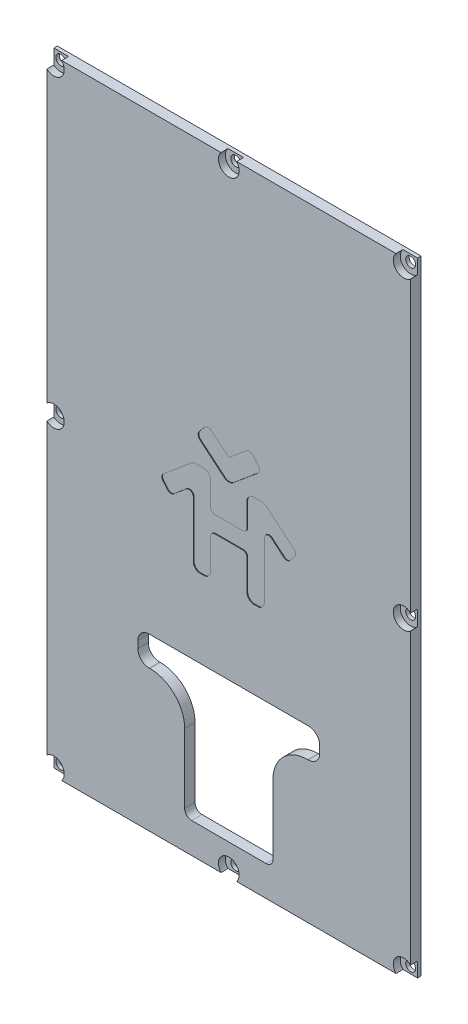
from build123d import *

# Parameters (mm, degrees)
SKETCH_1_W          = 105
SKETCH_1_H          = 180
EXTRUDE_1_DEPTH     = 3
CUT_EXTRUDE_1_DEPTH = 10
SKETCH_3_R          = 3
CUT_EXTRUDE_2_DEPTH = 2
SKETCH_4_R          = 1.425
CUT_EXTRUDE_3_DEPTH = 2
CUT_EXTRUDE_4_DEPTH = 0.2


with BuildPart() as part:
    # Эскиз1 → Бобышка-Вытянуть1 (new body)
    with BuildSketch(Plane.XY):
        Rectangle(SKETCH_1_W, SKETCH_1_H)
    extrude(amount=EXTRUDE_1_DEPTH)

    # Эскиз2 → Вырез-Вытянуть1 (cut)
    with BuildSketch(Plane(origin=(0, 0, 0), x_dir=(-1, 0, 0), z_dir=(0, 0, -1))):
        with BuildLine():
            Line((-26.25, -44), (-26.25, -46))
            ThreePointArc((-26.25, -46), (-25.298097039, -48.298097039), (-23, -49.25))
            Line((-23, -49.25), (-22.75, -49.25))
            ThreePointArc((-22.75, -49.25), (-15.678932188, -52.178932188), (-12.75, -59.25))
            Line((-12.75, -59.25), (-12.75, -79.25))
            ThreePointArc((-12.75, -79.25), (-12.164213562, -80.664213562), (-10.75, -81.25))
            Line((-10.75, -81.25), (10.75, -81.25))
            ThreePointArc((10.75, -81.25), (12.164213562, -80.664213562), (12.75, -79.25))
            Line((12.75, -79.25), (12.75, -59.25))
            ThreePointArc((12.75, -59.25), (15.678932188, -52.178932188), (22.75, -49.25))
            Line((22.75, -49.25), (23, -49.25))
            ThreePointArc((23, -49.25), (25.298097039, -48.298097039), (26.25, -46))
            Line((26.25, -46), (26.25, -44))
            ThreePointArc((26.25, -44), (25.298097039, -41.701902961), (23, -40.75))
            Line((23, -40.75), (-23, -40.75))
            ThreePointArc((-23, -40.75), (-25.298097039, -41.701902961), (-26.25, -44))
        make_face()
    extrude(amount=-CUT_EXTRUDE_1_DEPTH, mode=Mode.SUBTRACT)

    # Эскиз3 → Вырез-Вытянуть2 (cut)
    with BuildSketch(Plane.XY.offset(3)):
        with Locations((-50.5, 88)):
            Circle(SKETCH_3_R)
        with Locations((0, 88)):
            Circle(SKETCH_3_R)
        with Locations((50.5, 88)):
            Circle(SKETCH_3_R)
        with Locations((50.5, 0)):
            Circle(SKETCH_3_R)
        with Locations((50.5, -88)):
            Circle(SKETCH_3_R)
        with Locations((0, -88)):
            Circle(SKETCH_3_R)
        with Locations((-50.5, -88)):
            Circle(SKETCH_3_R)
        with Locations((-50.5, 0)):
            Circle(SKETCH_3_R)
    extrude(amount=-CUT_EXTRUDE_2_DEPTH, mode=Mode.SUBTRACT)

    # Эскиз4 → Вырез-Вытянуть3 (cut)
    with BuildSketch(Plane.XY.offset(1)):
        with Locations((-50.5, 88)):
            Circle(SKETCH_4_R)
        with Locations((0, 88)):
            Circle(SKETCH_4_R)
        with Locations((50.5, 88)):
            Circle(SKETCH_4_R)
        with Locations((50.5, 0)):
            Circle(SKETCH_4_R)
        with Locations((50.5, -88)):
            Circle(SKETCH_4_R)
        with Locations((0, -88)):
            Circle(SKETCH_4_R)
        with Locations((-50.5, -88)):
            Circle(SKETCH_4_R)
        with Locations((-50.5, 0)):
            Circle(SKETCH_4_R)
    extrude(amount=-CUT_EXTRUDE_3_DEPTH, mode=Mode.SUBTRACT)

    # Эскиз5 → Вырез-Вытянуть4 (cut)
    with BuildSketch(Plane.XY.offset(3)):
        with BuildLine():
            Line((-10.25, -0.09106889), (-10.25, -16.21851864))
            ThreePointArc((-10.25, -16.21851864), (-9.664213562, -17.632732202), (-8.25, -18.21851864))
            Line((-8.25, -18.21851864), (-7.25, -18.21851864))
            ThreePointArc((-7.25, -18.21851864), (-5.835786438, -17.632732202), (-5.25, -16.21851864))
            Line((-5.25, -16.21851864), (-5.25, -7.46851864))
            ThreePointArc((-5.25, -7.46851864), (-4.883883476, -6.584635164), (-4, -6.21851864))
            Line((-4, -6.21851864), (4, -6.21851864))
            ThreePointArc((4, -6.21851864), (4.883883476, -6.584635164), (5.25, -7.46851864))
            Line((5.25, -7.46851864), (5.25, -16.21851864))
            ThreePointArc((5.25, -16.21851864), (5.835786438, -17.632732202), (7.25, -18.21851864))
            Line((7.25, -18.21851864), (8.25, -18.21851864))
            ThreePointArc((8.25, -18.21851864), (9.664213562, -17.632732202), (10.25, -16.21851864))
            Line((10.25, -16.21851864), (10.25, -0.09106889))
            ThreePointArc((10.25, -0.09106889), (10.971727173, 1.041815844), (12.303484512, 0.866486664))
            Line((12.303484512, 0.866486664), (15.917557024, -2.166080248))
            ThreePointArc((15.917557024, -2.166080248), (16.829986215, -2.453768066), (17.67859709, -2.012009206))
            Line((17.67859709, -2.012009206), (19.022071027, -0.410919315))
            ThreePointArc((19.022071027, -0.410919315), (19.309758846, 0.501509876), (18.867999985, 1.350120751))
            Line((18.867999985, 1.350120751), (10.947043439, 7.996592468))
            ThreePointArc((10.947043439, 7.996592468), (10.195124773, 8.430712912), (9.340074414, 8.58148136))
            Line((9.340074414, 8.58148136), (7.25, 8.58148136))
            ThreePointArc((7.25, 8.58148136), (5.835786438, 7.995694922), (5.25, 6.58148136))
            Line((5.25, 6.58148136), (5.25, -0.16851864))
            ThreePointArc((5.25, -0.16851864), (4.883883476, -1.052402116), (4, -1.41851864))
            Line((4, -1.41851864), (-4, -1.41851864))
            ThreePointArc((-4, -1.41851864), (-4.883883476, -1.052402116), (-5.25, -0.16851864))
            Line((-5.25, -0.16851864), (-5.25, 6.58148136))
            ThreePointArc((-5.25, 6.58148136), (-5.835786438, 7.995694922), (-7.25, 8.58148136))
            Line((-7.25, 8.58148136), (-9.340074414, 8.58148136))
            ThreePointArc((-9.340074414, 8.58148136), (-10.195124773, 8.430712912), (-10.947043439, 7.996592468))
            Line((-10.947043439, 7.996592468), (-18.867999985, 1.350120751))
            ThreePointArc((-18.867999985, 1.350120751), (-19.309758846, 0.501509876), (-19.022071027, -0.410919315))
            Line((-19.022071027, -0.410919315), (-17.67859709, -2.012009206))
            ThreePointArc((-17.67859709, -2.012009206), (-16.829986215, -2.453768066), (-15.917557024, -2.166080248))
            Line((-15.917557024, -2.166080248), (-12.303484512, 0.866486664))
            ThreePointArc((-12.303484512, 0.866486664), (-10.971727173, 1.041815844), (-10.25, -0.09106889))
        make_face()
        with BuildLine():
            Line((0, 14.858517807), (-4.979473915, 19.036792532))
            ThreePointArc((-4.979473915, 19.036792532), (-6.074388944, 19.382017915), (-7.092721994, 18.851907282))
            Line((-7.092721994, 18.851907282), (-8.483871936, 17.193999341))
            ThreePointArc((-8.483871936, 17.193999341), (-8.829097318, 16.099084312), (-8.298986686, 15.080751262))
            Line((-8.298986686, 15.080751262), (-1.285575219, 9.195800287))
            ThreePointArc((-1.285575219, 9.195800287), (0, 8.727889173), (1.285575219, 9.195800287))
            Line((1.285575219, 9.195800287), (8.298986686, 15.080751262))
            ThreePointArc((8.298986686, 15.080751262), (8.829097318, 16.099084312), (8.483871936, 17.193999341))
            Line((8.483871936, 17.193999341), (7.092721994, 18.851907282))
            ThreePointArc((7.092721994, 18.851907282), (6.074388944, 19.382017915), (4.979473915, 19.036792532))
            Line((4.979473915, 19.036792532), (0, 14.858517807))
        make_face()
    extrude(amount=-CUT_EXTRUDE_4_DEPTH, mode=Mode.SUBTRACT)


solid = part.part
